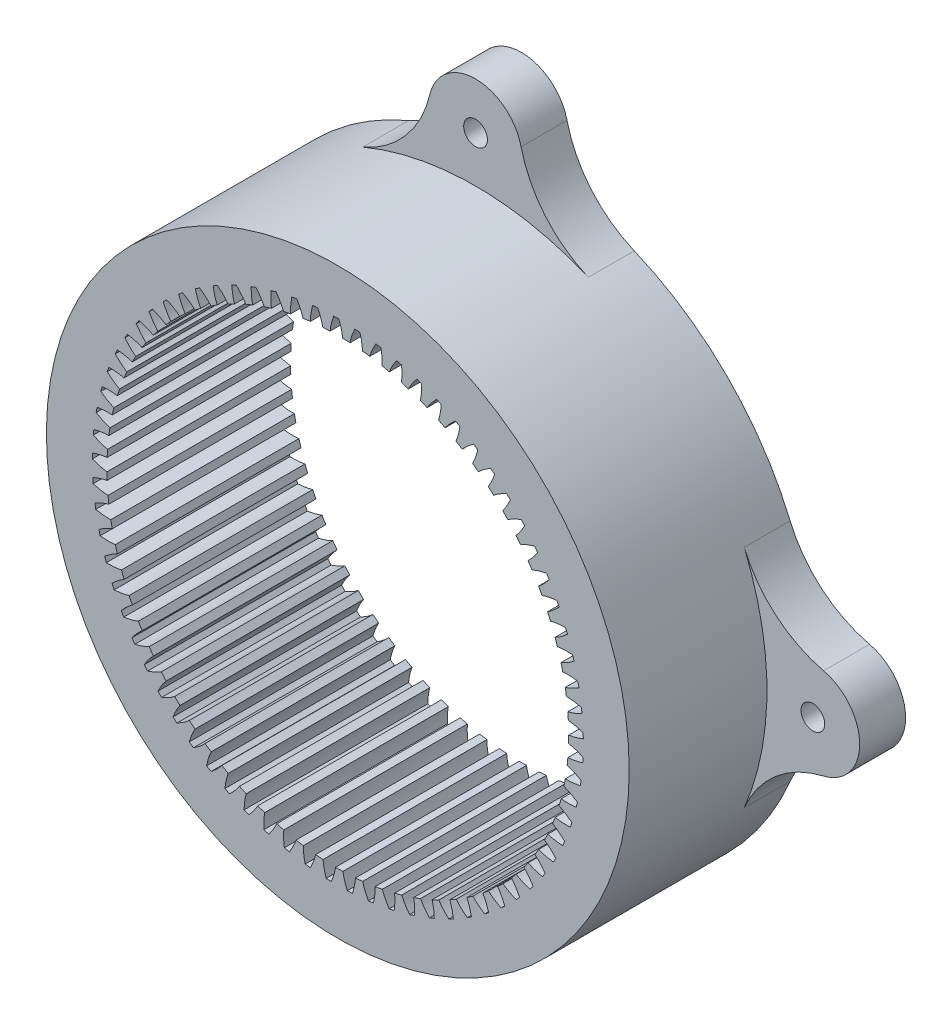
from build123d import *

# Parameters (mm, degrees)
SKETCH1_R                = 38.0875
BOSS_EXTRUDE1_DEPTH      = 24
SKETCH5_R                = 30.175
CUT_EXTRUDE1_DEPTH       = 59.968765567
CUT_EXTRUDE2_DEPTH       = 59.968765567
CIRPATTERN2_COUNT        = 73
SKETCH7_R                = 1.55
BOSS_EXTRUDE3_DEPTH      = 6
FILLET1_R                = 15
CIRPATTERN5_COUNT        = 4
FILLET1_OF_CIRPATTERN5_R = 15


with BuildPart() as part:
    # Sketch1 → Boss-Extrude1 (new body)
    with BuildSketch(Plane.XY):
        Circle(SKETCH1_R)
    extrude(amount=BOSS_EXTRUDE1_DEPTH)

    # Sketch5 → Cut-Extrude1 (cut, through all)
    with BuildSketch(Plane.XY.offset(24)):
        Circle(SKETCH5_R)
    extrude(amount=-CUT_EXTRUDE1_DEPTH, mode=Mode.SUBTRACT)

    # Sketch6 → Cut-Extrude2 (cut, symmetric)
    with BuildSketch(Plane.XY.offset(24)):
        with BuildLine():
            add(Edge.make_bspline(
                [(30.17499559, 0.016313616), (30.185111748, 0.017516903), (30.250228403, 0.025505599), (30.38888052, 0.045645396), (30.600601399, 0.085138374), (30.909883079, 0.15681176), (31.270724183, 0.258489687), (31.609391441, 0.370506489), (31.873204447, 0.468607714), (32.030489222, 0.53073161), (32.082755552, 0.551772091)],
                knots=[0.012611527, 0.012611527, 0.012611527, 0.012611527, 0.012611527, 0.015083688, 0.02853182, 0.046610139, 0.064854849, 0.092110525, 0.119476175, 0.133149574, 0.133149574, 0.133149574, 0.133149574, 0.133149574], degree=4))
            ThreePointArc((32.082755552, 0.551772091), (32.075219389, 0.887669652), (32.064166568, 1.22346989))
            add(Edge.make_bspline(
                [(30.129712075, 1.652596523), (30.1398793, 1.651954571), (30.205338117, 1.647579502), (30.344891882, 1.635138949), (30.558472936, 1.607416041), (30.871245262, 1.552957767), (31.237157554, 1.471392467), (31.58150175, 1.37827775), (31.850336638, 1.294917356), (32.010816553, 1.241587478), (32.064166568, 1.22346989)],
                knots=[0.012611527, 0.012611527, 0.012611527, 0.012611527, 0.012611527, 0.015083688, 0.02853182, 0.046610139, 0.064854849, 0.092110525, 0.119476175, 0.133149574, 0.133149574, 0.133149574, 0.133149574, 0.133149574], degree=4))
            ThreePointArc((30.129712075, 1.652596523), (30.163451346, 0.834762189), (30.17499559, 0.016313616))
        make_face()
    cut_extrude2 = extrude(amount=CUT_EXTRUDE2_DEPTH, both=True, mode=Mode.SUBTRACT)

    # CirPattern2: Cut-Extrude2 ×73 about axis
    cirpattern2_axis = Axis((0, 0, 24), (0, 0, -1))
    for i in range(1, CIRPATTERN2_COUNT):
        add(cut_extrude2.rotate(cirpattern2_axis, i * 360 / CIRPATTERN2_COUNT), mode=Mode.SUBTRACT)

    # Sketch7 → Boss-Extrude3 (add)
    with BuildSketch(Plane.XY):
        with BuildLine():
            Line((-44.0875, 6.120135742), (-37.592573665, 6.120135742))
            ThreePointArc((-37.592573665, 6.120135742), (-38.0875, 0), (-37.592573665, -6.120135742))
            Line((-37.592573665, -6.120135742), (-44.0875, -6.120135742))
            ThreePointArc((-44.0875, -6.120135742), (-50.207635742, 0), (-44.0875, 6.120135742))
        make_face()
        with Locations((-44.0875, 0)):
            Circle(SKETCH7_R, mode=Mode.SUBTRACT)
    boss_extrude3 = extrude(amount=BOSS_EXTRUDE3_DEPTH)

    # Fillet1
    # the kernel refuses this fillet: 15 mm, written as the material it adds along each edge
    with BuildSketch(Plane(origin=(-37.592573665, 6.120135742, 0), x_dir=(0.27584438414959905, 0.9612023073906597, 0), z_dir=(0, 0, 1))) as fillet1_piece_1:
        with BuildLine():
            CenterArc((10.741143284, 14.895545896), FILLET1_R, 209.315521003, 53.918866848)
            Line((-2.337906771, 7.551265833), (-3.645811776, 6.816837827))
            ThreePointArc((-3.645811776, 6.816837827), (-3.233392416, 5.829171603), (-1.441803461, -0.413766576))
            Line((-1.441803461, -0.413766576), (0.176711982, -1.48955459))
            ThreePointArc((0.176711982, -1.48955459), (4.487011734, -1.234773622), (8.797311486, -1.48955459))
            Line((8.797311486, -1.48955459), (8.974023468, 0))
        make_face()
    extrude(amount=6)
    with BuildSketch(Plane(origin=(-37.592573665, -6.120135742, 0), x_dir=(0.2758443841495975, -0.9612023073906603, 0), z_dir=(0, 0, 1))) as fillet1_piece_2:
        with BuildLine():
            CenterArc((10.741143284, -14.895545896), FILLET1_R, 96.765612149, 53.918866848)
            Line((-2.337906771, -7.551265833), (-3.645811776, -6.816837827))
            ThreePointArc((-3.645811776, -6.816837827), (-3.233392416, -5.829171603), (-1.441803461, 0.413766576))
            Line((-1.441803461, 0.413766576), (0.176711982, 1.48955459))
            ThreePointArc((0.176711982, 1.48955459), (4.487011734, 1.234773622), (8.797311486, 1.48955459))
            Line((8.797311486, 1.48955459), (8.974023468, 0))
        make_face()
    extrude(amount=6)

    # CirPattern5: Boss-Extrude3 ×4 about axis
    cirpattern5_axis = Axis((0, 0, 0), (0, 0, 1))
    for i in range(1, CIRPATTERN5_COUNT):
        add(boss_extrude3.rotate(cirpattern5_axis, i * 360 / CIRPATTERN5_COUNT))

    # Fillet1 of CirPattern5
    # the kernel refuses this fillet: 15 mm, written as the material it adds along each edge
    with BuildSketch(Plane(origin=(-6.120135742, -37.592573665, 0), x_dir=(-0.9612023073906635, 0.2758443841495858, 0), z_dir=(0, 0, 1)), Plane(origin=(37.592573665, -6.120135742, 0), x_dir=(-0.2758443841495911, -0.961202307390662, 0), z_dir=(0, 0, 1)), Plane(origin=(6.120135742, 37.592573665, 0), x_dir=(0.9612023073906582, -0.27584438414960466, 0), z_dir=(0, 0, 1))) as fillet1_of_cirpattern5_piece_1:
        with BuildLine():
            CenterArc((10.741143284, 14.895545896), FILLET1_OF_CIRPATTERN5_R, 209.315521003, 53.918866848)
            Line((-2.337906771, 7.551265833), (-3.645811776, 6.816837827))
            ThreePointArc((-3.645811776, 6.816837827), (-3.233392416, 5.829171603), (-1.441803461, -0.413766576))
            Line((-1.441803461, -0.413766576), (0.176711982, -1.48955459))
            ThreePointArc((0.176711982, -1.48955459), (4.487011734, -1.234773622), (8.797311486, -1.48955459))
            Line((8.797311486, -1.48955459), (8.974023468, 0))
        make_face()
    extrude(amount=6)
    with BuildSketch(Plane(origin=(6.120135742, -37.592573665, 0), x_dir=(0.9612023073906618, 0.2758443841495923, 0), z_dir=(0, 0, 1)), Plane(origin=(37.592573665, 6.120135742, 0), x_dir=(-0.27584438414960377, 0.9612023073906584, 0), z_dir=(0, 0, 1)), Plane(origin=(-6.120135742, 37.592573665, 0), x_dir=(-0.9612023073906568, -0.2758443841496094, 0), z_dir=(0, 0, 1))) as fillet1_of_cirpattern5_piece_2:
        with BuildLine():
            CenterArc((10.741143284, -14.895545896), FILLET1_OF_CIRPATTERN5_R, 96.765612149, 53.918866848)
            Line((-2.337906771, -7.551265833), (-3.645811776, -6.816837827))
            ThreePointArc((-3.645811776, -6.816837827), (-3.233392416, -5.829171603), (-1.441803461, 0.413766576))
            Line((-1.441803461, 0.413766576), (0.176711982, 1.48955459))
            ThreePointArc((0.176711982, 1.48955459), (4.487011734, 1.234773622), (8.797311486, 1.48955459))
            Line((8.797311486, 1.48955459), (8.974023468, 0))
        make_face()
    extrude(amount=6)


solid = part.part
